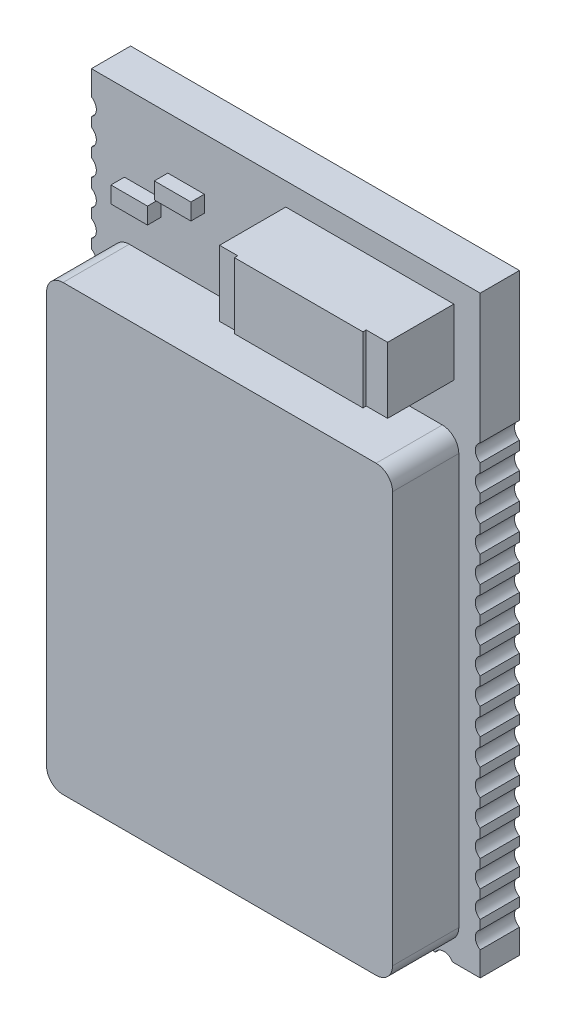
from build123d import *

# Parameters (mm, degrees)
SKETCH1_W               = 11.8
SKETCH1_H               = 18
BOSS_EXTRUDE1_DEPTH     = 1.19
SKETCH2_W               = 10.5
SKETCH2_H               = 13.46
BOSS_EXTRUDE2_DEPTH     = 3.2
FILLET11_R              = 0.5
FILLET12_R              = 0.5
FILLET13_R              = 0.5
FILLET14_R              = 0.5
SKETCH9_R               = 0.3
CUT_EXTRUDE5_DEPTH      = 3.2
SKETCH14_W              = 5.1
SKETCH14_H              = 2
BOSS_EXTRUDE3_DEPTH     = 3.2
SKETCH15_W              = 3.9
SKETCH15_H              = 2
BOSS_EXTRUDE4_DEPTH     = 3.3
CUT_EXTRUDE6_DEPTH      = 22.774526401
CUT_EXTRUDE6_DEPTH_BACK = 22.774526401
SKETCH16_R              = 0.3
CUT_EXTRUDE9_DEPTH      = 22.774526401
CUT_EXTRUDE9_DEPTH_BACK = 3.2
SKETCH17_R              = 0.3
SKETCH19_W              = 1.11
SKETCH19_H              = 0.5
BOSS_EXTRUDE6_DEPTH     = 1.6
SKETCH20_W              = 1.11
SKETCH20_H              = 0.5
BOSS_EXTRUDE7_DEPTH     = 1.6


with BuildPart() as part:
    # Sketch1 → Boss-Extrude1 (new body)
    with BuildSketch(Plane.XY):
        with Locations((5.9, 9)):
            Rectangle(SKETCH1_W, SKETCH1_H)
    extrude(amount=BOSS_EXTRUDE1_DEPTH)

    # Sketch2 → Boss-Extrude2 (add)
    with BuildSketch(Plane.XY):
        with Locations((5.9, 7.23)):
            Rectangle(SKETCH2_W, SKETCH2_H)
    extrude(amount=BOSS_EXTRUDE2_DEPTH)

    # Fillet11
    fillet11_edges = [part.edges().sort_by_distance(p)[0] for p in [
        (0.65, 13.96, 2.195),
    ]]
    fillet(fillet11_edges, radius=FILLET11_R)

    # Fillet12
    fillet12_edges = [part.edges().sort_by_distance(p)[0] for p in [
        (0.65, 0.5, 2.195),
    ]]
    fillet(fillet12_edges, radius=FILLET12_R)

    # Fillet13
    fillet13_edges = [part.edges().sort_by_distance(p)[0] for p in [
        (11.15, 0.5, 2.195),
    ]]
    fillet(fillet13_edges, radius=FILLET13_R)

    # Fillet14
    fillet14_edges = [part.edges().sort_by_distance(p)[0] for p in [
        (11.15, 13.96, 2.195),
    ]]
    fillet(fillet14_edges, radius=FILLET14_R)

    # Sketch9 → Cut-Extrude5 (cut)
    with BuildSketch(Plane.XY):
        with Locations((1.1, -0.15)):
            Circle(SKETCH9_R)
        with Locations((1.9, -0.15)):
            Circle(SKETCH9_R)
        with Locations((2.7, -0.15)):
            Circle(SKETCH9_R)
        with Locations((3.5, -0.15)):
            Circle(SKETCH9_R)
        with Locations((4.3, -0.15)):
            Circle(SKETCH9_R)
        with Locations((5.1, -0.15)):
            Circle(SKETCH9_R)
        with Locations((5.9, -0.15)):
            Circle(SKETCH9_R)
        with Locations((6.7, -0.15)):
            Circle(SKETCH9_R)
        with Locations((7.5, -0.15)):
            Circle(SKETCH9_R)
        with Locations((8.3, -0.15)):
            Circle(SKETCH9_R)
        with Locations((9.1, -0.15)):
            Circle(SKETCH9_R)
        with Locations((9.9, -0.15)):
            Circle(SKETCH9_R)
        with Locations((10.7, -0.15)):
            Circle(SKETCH9_R)
    extrude(amount=CUT_EXTRUDE5_DEPTH, mode=Mode.SUBTRACT)

    # Sketch14 → Boss-Extrude3 (add)
    with BuildSketch(Plane.XY):
        with Locations((8.45, 16.312688451)):
            Rectangle(SKETCH14_W, SKETCH14_H)
    extrude(amount=BOSS_EXTRUDE3_DEPTH)

    # Sketch15 → Boss-Extrude4 (add)
    with BuildSketch(Plane.XY):
        with Locations((8.401012654, 16.312688451)):
            Rectangle(SKETCH15_W, SKETCH15_H)
    extrude(amount=BOSS_EXTRUDE4_DEPTH)

    # Sketch16 → Cut-Extrude6 (cut, two sides: drawn at the far end of the back side and taken through both)
    with BuildSketch(Plane.XY.offset(-CUT_EXTRUDE6_DEPTH_BACK)):
        with Locations((-0.15, 1)):
            Circle(SKETCH16_R)
        with Locations((-0.15, 1.8)):
            Circle(SKETCH16_R)
        with Locations((-0.15, 2.6)):
            Circle(SKETCH16_R)
        with Locations((-0.15, 3.4)):
            Circle(SKETCH16_R)
        with Locations((-0.15, 4.2)):
            Circle(SKETCH16_R)
        with Locations((-0.15, 5)):
            Circle(SKETCH16_R)
        with Locations((-0.15, 5.8)):
            Circle(SKETCH16_R)
        with Locations((-0.15, 6.6)):
            Circle(SKETCH16_R)
        with Locations((-0.15, 7.4)):
            Circle(SKETCH16_R)
        with Locations((-0.15, 8.2)):
            Circle(SKETCH16_R)
        with Locations((-0.15, 9)):
            Circle(SKETCH16_R)
        with Locations((-0.15, 9.8)):
            Circle(SKETCH16_R)
        with Locations((-0.15, 10.6)):
            Circle(SKETCH16_R)
        with Locations((-0.15, 11.4)):
            Circle(SKETCH16_R)
        with Locations((-0.15, 12.2)):
            Circle(SKETCH16_R)
        with Locations((-0.15, 13)):
            Circle(SKETCH16_R)
        with Locations((-0.15, 13.8)):
            Circle(SKETCH16_R)
        with Locations((-0.15, 14.6)):
            Circle(SKETCH16_R)
        with Locations((-0.15, 15.4)):
            Circle(SKETCH16_R)
        with Locations((-0.15, 16.2)):
            Circle(SKETCH16_R)
        with Locations((-0.15, 17)):
            Circle(SKETCH16_R)
    extrude(amount=CUT_EXTRUDE6_DEPTH + CUT_EXTRUDE6_DEPTH_BACK, mode=Mode.SUBTRACT)

    # Sketch17 → Cut-Extrude9 (cut, two sides: drawn at the far end of the back side and taken through both)
    with BuildSketch(Plane.XY.offset(-CUT_EXTRUDE9_DEPTH_BACK)):
        with Locations((11.95, 1)):
            Circle(SKETCH17_R)
        with Locations((11.95, 1.8)):
            Circle(SKETCH17_R)
        with Locations((11.95, 2.6)):
            Circle(SKETCH17_R)
        with Locations((11.95, 3.4)):
            Circle(SKETCH17_R)
        with Locations((11.95, 4.2)):
            Circle(SKETCH17_R)
        with Locations((11.95, 5)):
            Circle(SKETCH17_R)
        with Locations((11.95, 5.8)):
            Circle(SKETCH17_R)
        with Locations((11.95, 6.6)):
            Circle(SKETCH17_R)
        with Locations((11.95, 7.4)):
            Circle(SKETCH17_R)
        with Locations((11.95, 8.2)):
            Circle(SKETCH17_R)
        with Locations((11.95, 9)):
            Circle(SKETCH17_R)
        with Locations((11.95, 9.8)):
            Circle(SKETCH17_R)
        with Locations((11.95, 10.6)):
            Circle(SKETCH17_R)
        with Locations((11.95, 11.4)):
            Circle(SKETCH17_R)
        with Locations((11.95, 12.2)):
            Circle(SKETCH17_R)
        with Locations((11.95, 13)):
            Circle(SKETCH17_R)
        with Locations((11.95, 13.8)):
            Circle(SKETCH17_R)
    extrude(amount=CUT_EXTRUDE9_DEPTH + CUT_EXTRUDE9_DEPTH_BACK, mode=Mode.SUBTRACT)

    # Sketch19 → Boss-Extrude6 (add)
    with BuildSketch(Plane.XY):
        with Locations((2.875, 16.16471376)):
            Rectangle(SKETCH19_W, SKETCH19_H)
    extrude(amount=BOSS_EXTRUDE6_DEPTH)

    # Sketch20 → Boss-Extrude7 (add)
    with BuildSketch(Plane.XY):
        with Locations((1.55773637, 15.39942892)):
            Rectangle(SKETCH20_W, SKETCH20_H)
    extrude(amount=BOSS_EXTRUDE7_DEPTH)


solid = part.part
